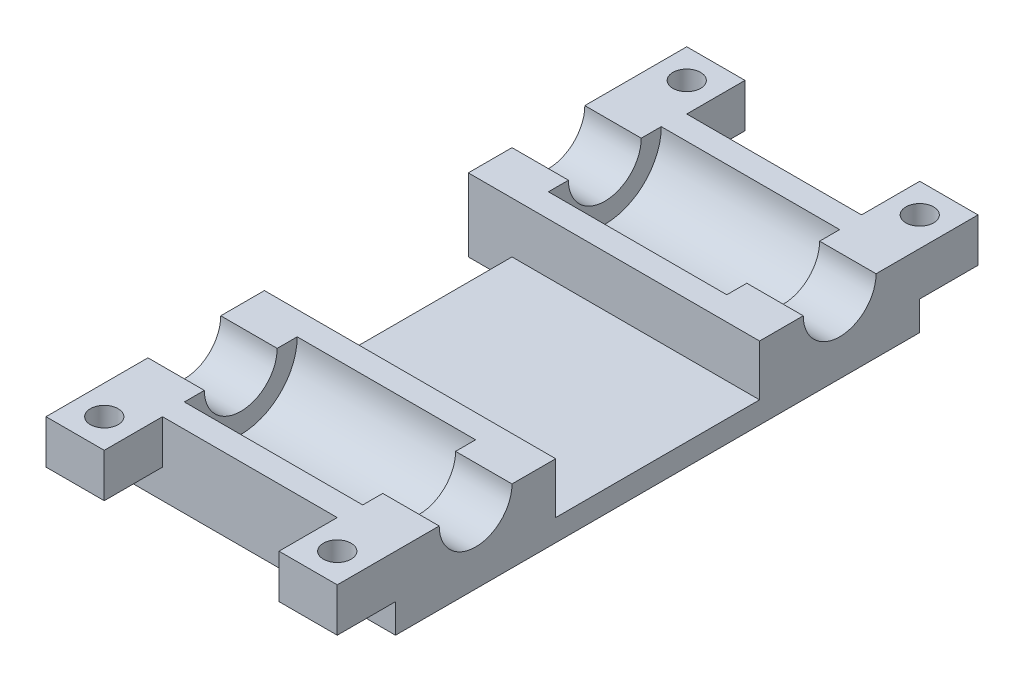
from build123d import *

# Parameters (mm, degrees)
SKETCH1_W                  = 40
SKETCH1_H                  = 22
BOSS_EXTRUDE1_DEPTH        = 11
SKETCH2_W                  = 40
SKETCH2_H                  = 22
SKETCH2_R                  = 7.843750423
BOSS_EXTRUDE2_DEPTH        = 5
SKETCH3_W                  = 24.5
SKETCH3_H                  = 15.5
CUT_EXTRUDE1_DEPTH         = 7.75
FILLET1_R                  = 7.75
SKETCH4_R                  = 5
CUT_EXTRUDE2_DEPTH         = 36.805900352
SKETCH5_W                  = 8
SKETCH5_H                  = 8
SKETCH5_R                  = 1.905800151
BOSS_EXTRUDE3_DEPTH        = 6
CUT_EXTRUDE3_START         = -3
SKETCH6_R                  = 3
SKETCH6_R_2                = 1.905800151
CUT_EXTRUDE3_DEPTH         = 3
SKETCH7_W                  = 16
SKETCH7_H                  = 16.5
BOSS_EXTRUDE5_DEPTH        = 28
MIRROR14_COPY_1_SKETCH_W   = 8
MIRROR14_COPY_1_SKETCH_H   = 8
MIRROR14_COPY_1_SKETCH_R   = 1.905800151
MIRROR14_COPY_1_DEPTH      = 6
MIRROR14_START             = -3
MIRROR14_COPY_2_SKETCH_R   = 3
MIRROR14_COPY_2_SKETCH_R_2 = 1.905800151
MIRROR14_COPY_2_DEPTH      = 3
FILLET1_OF_MIRROR14_R      = 7.75
SKETCH9_W                  = 28
SKETCH9_H                  = 3
BOSS_EXTRUDE6_DEPTH        = 18
CUT_EXTRUDE4_DEPTH         = 10
CUT_EXTRUDE5_DEPTH         = 73.919476136
CUT_EXTRUDE5_DEPTH_BACK    = 73.919476136
SKETCH11_R                 = 1.75
CUT_EXTRUDE6_DEPTH         = 76.121568141
CUT_EXTRUDE6_DEPTH_BACK    = 76.121568141
SKETCH12_R                 = 1.75
CUT_EXTRUDE9_DEPTH         = 12
CUT_EXTRUDE11_START        = -10
SKETCH16_R                 = 4
SKETCH16_R_2               = 1.75
SKETCH16_W                 = 10
SKETCH16_H                 = 6.5
CUT_EXTRUDE11_DEPTH        = 10
FILLET2_R                  = 2
SKETCH17_W                 = 34
SKETCH17_H                 = 28
CUT_EXTRUDE12_DEPTH        = 74.097537578
SKETCH18_R                 = 1.75
BOSS_EXTRUDE7_DEPTH        = 3
SKETCH19_W                 = 8
SKETCH19_H                 = 8
SKETCH19_R                 = 1.905800151
BOSS_EXTRUDE8_DEPTH        = 3
CUT_EXTRUDE13_START        = -3
SKETCH20_R                 = 1.905800151
CUT_EXTRUDE13_DEPTH        = 3
SKETCH21_W                 = 40
SKETCH21_H                 = 22
CUT_EXTRUDE14_DEPTH        = 73.532751223


# Some blends are built 0.0001 mm under size
with BuildPart() as part:
    # Sketch1 → Boss-Extrude1 (new body)
    with BuildSketch(Plane(origin=(0, 0, 0), x_dir=(1, 0, 0), z_dir=(0, 1, 0))):
        Rectangle(SKETCH1_W, SKETCH1_H)
    boss_extrude1 = extrude(amount=BOSS_EXTRUDE1_DEPTH)

    # Sketch2 → Boss-Extrude2 (add)
    with BuildSketch(Plane(origin=(0, 0, 0), x_dir=(1, 0, 0), z_dir=(0, 1, 0))):
        Rectangle(SKETCH2_W, SKETCH2_H)
        with Locations(Location((0, 0, 0), (0, 0, 270))):
            Circle(SKETCH2_R, mode=Mode.SUBTRACT)
    boss_extrude2 = extrude(amount=-BOSS_EXTRUDE2_DEPTH)

    # Sketch3 → Cut-Extrude1 (cut)
    with BuildSketch(Plane(origin=(0, 11, 0), x_dir=(1, 0, 0), z_dir=(0, 1, 0))):
        Rectangle(SKETCH3_W, SKETCH3_H)
    cut_extrude1 = extrude(amount=-CUT_EXTRUDE1_DEPTH, mode=Mode.SUBTRACT)

    # Fillet1
    fillet1_edges = [part.edges().sort_by_distance(p)[0] for p in [
        (0, 3.25, 7.75),
        (0, 3.25, -7.75),
    ]]
    fillet(fillet1_edges, radius=FILLET1_R - 0.0001)  # a hair under: the kernel refuses the full size

    # Sketch4 → Cut-Extrude2 (cut, symmetric)
    with BuildSketch(Plane(origin=(-12.25, 0, 0), x_dir=(0, 0, -1), z_dir=(1, 0, 0))):
        with Locations((0, 11)):
            Circle(SKETCH4_R)
    cut_extrude2 = extrude(amount=CUT_EXTRUDE2_DEPTH, both=True, mode=Mode.SUBTRACT)

    # Sketch5 → Boss-Extrude3 (add)
    with BuildSketch(Plane(origin=(0, 11, 0), x_dir=(1, 0, 0), z_dir=(0, 1, 0))):
        with Locations((16, -15)):
            Rectangle(SKETCH5_W, SKETCH5_H)
        with Locations(Location((16, -15, 0), (0, 0, 270))):
            Circle(SKETCH5_R, mode=Mode.SUBTRACT)
    boss_extrude3 = extrude(amount=-BOSS_EXTRUDE3_DEPTH)

    # Sketch6 → Cut-Extrude3 (cut)
    with BuildSketch(Plane.XZ.offset(-5).offset(CUT_EXTRUDE3_START)):
        with Locations(Location((16, 15, 0), (0, 0, 270))):
            Circle(SKETCH6_R)
        with Locations(Location((16, 15, 0), (0, 0, 90))):
            Circle(SKETCH6_R_2, mode=Mode.SUBTRACT)
    cut_extrude3 = extrude(amount=CUT_EXTRUDE3_DEPTH, mode=Mode.SUBTRACT)

    # Mirror8: Boss-Extrude3, Cut-Extrude3 across plane
    add(boss_extrude3.mirror(Plane(origin=(0, 0, 0), x_dir=(0, 0, 1), z_dir=(1, 0, 0))))
    add(cut_extrude3.mirror(Plane(origin=(0, 0, 0), x_dir=(0, 0, 1), z_dir=(1, 0, 0))), mode=Mode.SUBTRACT)

    # Sketch7 → Boss-Extrude5 (add)
    with BuildSketch(Plane(origin=(0, 0, -11), x_dir=(-1, 0, 0), z_dir=(0, 0, -1))):
        with Locations((-12, 9.25)):
            Rectangle(SKETCH7_W, SKETCH7_H)
    extrude(amount=BOSS_EXTRUDE5_DEPTH)

    # Mirror14: Boss-Extrude1, Boss-Extrude2, Cut-Extrude1, Cut-Extrude2, Boss-Extrude3, Cut-Extrude3 across plane
    add(boss_extrude1.mirror(Plane.XY.offset(-25)))
    add(boss_extrude2.mirror(Plane.XY.offset(-25)))
    add(cut_extrude1.mirror(Plane.XY.offset(-25)), mode=Mode.SUBTRACT)
    add(cut_extrude2.mirror(Plane.XY.offset(-25)), mode=Mode.SUBTRACT)
    add(boss_extrude3.mirror(Plane.XY.offset(-25)))
    add(cut_extrude3.mirror(Plane.XY.offset(-25)), mode=Mode.SUBTRACT)

    # Mirror14 copy 1 sketch → Mirror14 copy 1 (add)
    with BuildSketch(Plane(origin=(0, 11, -50), x_dir=(-1, 0, 0), z_dir=(0, 1, 0))):
        with Locations((16, -15)):
            Rectangle(MIRROR14_COPY_1_SKETCH_W, MIRROR14_COPY_1_SKETCH_H)
        with Locations(Location((16, -15, 0), (0, 0, 270))):
            Circle(MIRROR14_COPY_1_SKETCH_R, mode=Mode.SUBTRACT)
    extrude(amount=-MIRROR14_COPY_1_DEPTH)

    # Mirror14 copy 2 sketch → Mirror14 copy 2 (cut)
    with BuildSketch(Plane(origin=(0, 5, -50), x_dir=(-1, 0, 0), z_dir=(0, -1, 0)).offset(MIRROR14_START)):
        with Locations(Location((16, 15, 0), (0, 0, 270))):
            Circle(MIRROR14_COPY_2_SKETCH_R)
        with Locations(Location((16, 15, 0), (0, 0, 90))):
            Circle(MIRROR14_COPY_2_SKETCH_R_2, mode=Mode.SUBTRACT)
    extrude(amount=MIRROR14_COPY_2_DEPTH, mode=Mode.SUBTRACT)

    # Fillet1 of Mirror14
    fillet1_of_mirror14_edges = [part.edges().sort_by_distance(p)[0] for p in [
        (0, 3.25, -57.75),
        (0, 3.25, -42.25),
    ]]
    fillet(fillet1_of_mirror14_edges, radius=FILLET1_OF_MIRROR14_R - 0.0001)  # a hair under: the kernel refuses the full size

    # Sketch9 → Boss-Extrude6 (add)
    with BuildSketch(Plane.ZY.offset(-4)):
        with Locations((-25, 2.5)):
            Rectangle(SKETCH9_W, SKETCH9_H)
    extrude(amount=BOSS_EXTRUDE6_DEPTH)

    # Sketch10 → Cut-Extrude4 (cut)
    with BuildSketch(Plane(origin=(0, 17.5, 0), x_dir=(1, 0, 0), z_dir=(0, 1, 0))):
        with BuildLine():
            Line((9, 26.25), (9, 23.75))
            Line((9, 23.75), (11.727178029, 23.75))
            ThreePointArc((11.727178029, 23.75), (11.931001031, 24.360286817), (12, 25))
            ThreePointArc((12, 25), (11.931001031, 25.639713183), (11.727178029, 26.25))
            Line((11.727178029, 26.25), (9, 26.25))
        make_face()
        with BuildLine():
            Line((11.727178029, 23.75), (9, 23.75))
            Line((9, 23.75), (9, 26.25))
            Line((9, 26.25), (11.727178029, 26.25))
            ThreePointArc((11.727178029, 26.25), (6, 25), (11.727178029, 23.75))
        make_face()
        with BuildLine():
            ThreePointArc((12, 25), (11.931001031, 24.360286817), (11.727178029, 23.75))
            Line((11.727178029, 23.75), (20, 23.75))
            Line((20, 23.75), (20, 26.25))
            Line((20, 26.25), (11.727178029, 26.25))
            ThreePointArc((11.727178029, 26.25), (11.931001031, 25.639713183), (12, 25))
        make_face()
    extrude(amount=-CUT_EXTRUDE4_DEPTH, mode=Mode.SUBTRACT)

    # Sketch11 → Cut-Extrude5 (cut, two sides: drawn at the far end of the back side and taken through both)
    with BuildSketch(Plane(origin=(0, 7.5, 0), x_dir=(1, 0, 0), z_dir=(0, 1, 0)).offset(-CUT_EXTRUDE5_DEPTH_BACK)):
        with Locations(Location((9, 25, 0), (0, 0, 270))):
            Circle(SKETCH11_R)
    extrude(amount=CUT_EXTRUDE5_DEPTH + CUT_EXTRUDE5_DEPTH_BACK, mode=Mode.SUBTRACT)

    # Sketch12 → Cut-Extrude6 (cut, two sides: drawn at the far end of the back side and taken through both)
    with BuildSketch(Plane.ZY.offset(-4).offset(-CUT_EXTRUDE6_DEPTH_BACK)):
        with Locations((-33, 11)):
            Circle(SKETCH12_R)
    extrude(amount=CUT_EXTRUDE6_DEPTH + CUT_EXTRUDE6_DEPTH_BACK, mode=Mode.SUBTRACT)

    # Sketch15 → Cut-Extrude9 (cut)
    with BuildSketch(Plane(origin=(20, 0, 0), x_dir=(0, 0, -1), z_dir=(1, 0, 0))):
        Polygon((33, 14.175426481), (30.25, 12.58771324), (30.25, 9.41228676), (33, 7.824573519), (35.75, 9.41228676), (35.75, 12.58771324), align=None)
    extrude(amount=-CUT_EXTRUDE9_DEPTH, mode=Mode.SUBTRACT)

    # Sketch16 → Cut-Extrude11 (cut)
    # profile 1 of 2: a face of its own
    with BuildSketch(Plane(origin=(20, 0, 0), x_dir=(0, 0, -1), z_dir=(1, 0, 0)).offset(CUT_EXTRUDE11_START)):
        with Locations((33, 11)):
            Circle(SKETCH16_R)
        with Locations((33, 11)):
            Circle(SKETCH16_R_2, mode=Mode.SUBTRACT)
    # profile 2 of 2: a face of its own
    with BuildSketch(Plane(origin=(20, 0, 0), x_dir=(0, 0, -1), z_dir=(1, 0, 0)).offset(CUT_EXTRUDE11_START)):
        with Locations((34, 14.25)):
            Rectangle(SKETCH16_W, SKETCH16_H)
    extrude(amount=CUT_EXTRUDE11_DEPTH, mode=Mode.SUBTRACT)

    # Chamfer3
    # the kernel refuses this chamfer: 2.5 mm, written as the material it takes off along each edge
    with BuildSketch(Plane(origin=(4.790141486, 11, -37), x_dir=(0, -0.9712202897009368, 0.23818301550116588), z_dir=(1, 0, 0))) as chamfer3_piece_1_section:
        with BuildLine():
            Line((1.641163776, 0), (-0.550057664, 2.010038976))
            Line((-0.550057664, 2.010038976), (-0.598618679, 1.998129825))
            ThreePointArc((-0.598618679, 1.998129825), (-0.296653042, 0.999716345), (-0.048561014, -0.011909151))
            Line((-0.048561014, -0.011909151), (0.011909151, -0.048561014))
            ThreePointArc((0.011909151, -0.048561014), (0.818444442, 0.062835502), (1.633479525, -0.049405994))
            Line((1.633479525, -0.049405994), (1.641163776, 0))
        make_face()
    chamfer3_piece_1 = extrude(amount=20.419717028, mode=Mode.PRIVATE)
    chamfer3_piece_1 = split(chamfer3_piece_1, bisect_by=Plane(origin=(10, 11.063270064, -39.03704072), z_dir=(-1, 0, 0)), keep=Keep.TOP, mode=Mode.PRIVATE)
    chamfer3_piece_1 = split(chamfer3_piece_1, bisect_by=Plane(origin=(7.395070743, 11.063270064, -39), z_dir=(0, 0, -1)), keep=Keep.TOP, mode=Mode.PRIVATE)
    add(chamfer3_piece_1, mode=Mode.SUBTRACT)
    with BuildSketch(Plane(origin=(10, 11, -37), x_dir=(0, -0.9712202897009377, 0.23818301550116178), z_dir=(1, 0, 0))) as chamfer3_piece_2_section:
        with BuildLine():
            Line((1.641163776, 0), (-0.550057664, 2.010038976))
            Line((-0.550057664, 2.010038976), (-0.598618679, 1.998129825))
            ThreePointArc((-0.598618679, 1.998129825), (-0.296653042, 0.999716345), (-0.048561014, -0.011909151))
            Line((-0.048561014, -0.011909151), (0.011909151, -0.048561014))
            ThreePointArc((0.011909151, -0.048561014), (0.818444442, 0.062835502), (1.633479525, -0.049405994))
            Line((1.633479525, -0.049405994), (1.641163776, 0))
        make_face()
    chamfer3_piece_2 = extrude(amount=15.209858514, mode=Mode.PRIVATE)
    chamfer3_piece_2 = split(chamfer3_piece_2, bisect_by=Plane(origin=(17.604929257, 10.514615405, -39), z_dir=(0, 0, 1)), keep=Keep.TOP, mode=Mode.PRIVATE)
    add(chamfer3_piece_2, mode=Mode.SUBTRACT)
    with BuildSketch(Plane(origin=(10, 11, -37), x_dir=(0, -0.9712202897009377, 0.23818301550116178), z_dir=(1, 0, 0))) as chamfer3_piece_3_section:
        with BuildLine():
            Line((1.641163776, 0), (-0.550057664, 2.010038976))
            Line((-0.550057664, 2.010038976), (-0.598618679, 1.998129825))
            ThreePointArc((-0.598618679, 1.998129825), (-0.296653042, 0.999716345), (-0.048561014, -0.011909151))
            Line((-0.048561014, -0.011909151), (0.011909151, -0.048561014))
            ThreePointArc((0.011909151, -0.048561014), (0.818444442, 0.062835502), (1.633479525, -0.049405994))
            Line((1.633479525, -0.049405994), (1.641163776, 0))
        make_face()
    chamfer3_piece_3 = extrude(amount=15.209858514, mode=Mode.PRIVATE)
    chamfer3_piece_3 = split(chamfer3_piece_3, bisect_by=Plane(origin=(17.604929257, 11.063270064, -39), z_dir=(0, 0, -1)), keep=Keep.TOP, mode=Mode.PRIVATE)
    add(chamfer3_piece_3, mode=Mode.SUBTRACT)

    # Fillet2
    fillet2_edges = [part.edges().sort_by_distance(p)[0] for p in [
        (11.727178029, 12.5, -23.75),
        (11.727178029, 12.5, -26.25),
    ]]
    fillet(fillet2_edges, radius=FILLET2_R)

    # Sketch17 → Cut-Extrude12 (cut, through all)
    with BuildSketch(Plane(origin=(0, 4, 0), x_dir=(1, 0, 0), z_dir=(0, 1, 0))):
        with Locations((3, 25)):
            Rectangle(SKETCH17_W, SKETCH17_H)
    extrude(amount=CUT_EXTRUDE12_DEPTH, mode=Mode.SUBTRACT)

    # Sketch18 → Boss-Extrude7 (add)
    with BuildSketch(Plane(origin=(0, 4, 0), x_dir=(1, 0, 0), z_dir=(0, 1, 0))):
        with Locations((9, 25)):
            Circle(SKETCH18_R)
    extrude(amount=-BOSS_EXTRUDE7_DEPTH)

    # Sketch19 → Boss-Extrude8 (add)
    # profile 1 of 4: a face of its own
    with BuildSketch(Plane.XZ.offset(-8)):
        with Locations((-16, -65)):
            Rectangle(SKETCH19_W, SKETCH19_H)
        with Locations(Location((-16, -65, 0), (0, 0, 270))):
            Circle(SKETCH19_R, mode=Mode.SUBTRACT)
    # profile 2 of 4: a face of its own
    with BuildSketch(Plane.XZ.offset(-8)):
        with Locations((16, -65)):
            Rectangle(SKETCH19_W, SKETCH19_H)
        with Locations(Location((16, -65, 0), (0, 0, 270))):
            Circle(SKETCH19_R, mode=Mode.SUBTRACT)
    # profile 3 of 4: a face of its own
    with BuildSketch(Plane.XZ.offset(-8)):
        with Locations((16, 15)):
            Rectangle(SKETCH19_W, SKETCH19_H)
        with Locations(Location((16, 15, 0), (0, 0, 90))):
            Circle(SKETCH19_R, mode=Mode.SUBTRACT)
    # profile 4 of 4: a face of its own
    with BuildSketch(Plane.XZ.offset(-8)):
        with Locations((-16, 15)):
            Rectangle(SKETCH19_W, SKETCH19_H)
        with Locations(Location((-16, 15, 0), (0, 0, 90))):
            Circle(SKETCH19_R, mode=Mode.SUBTRACT)
    extrude(amount=BOSS_EXTRUDE8_DEPTH)

    # Sketch20 → Cut-Extrude13 (cut)
    # profile 1 of 4: a face of its own
    with BuildSketch(Plane.XZ.offset(-5).offset(CUT_EXTRUDE13_START)):
        Polygon((-12.824573519, 15), (-14.41228676, 17.75), (-17.58771324, 17.75), (-19.175426481, 15), (-17.58771324, 12.25), (-14.41228676, 12.25), align=None)
        with Locations(Location((-16, 15, 0), (0, 0, 90))):
            Circle(SKETCH20_R, mode=Mode.SUBTRACT)
    # profile 2 of 4: a face of its own
    with BuildSketch(Plane.XZ.offset(-5).offset(CUT_EXTRUDE13_START)):
        Polygon((19.175426481, 15), (17.58771324, 17.75), (14.41228676, 17.75), (12.824573519, 15), (14.41228676, 12.25), (17.58771324, 12.25), align=None)
        with Locations(Location((16, 15, 0), (0, 0, 90))):
            Circle(SKETCH20_R, mode=Mode.SUBTRACT)
    # profile 3 of 4: a face of its own
    with BuildSketch(Plane.XZ.offset(-5).offset(CUT_EXTRUDE13_START)):
        Polygon((19.175426481, -65), (17.58771324, -62.25), (14.41228676, -62.25), (12.824573519, -65), (14.41228676, -67.75), (17.58771324, -67.75), align=None)
        with Locations(Location((16, -65, 0), (0, 0, 270))):
            Circle(SKETCH20_R, mode=Mode.SUBTRACT)
    # profile 4 of 4: a face of its own
    with BuildSketch(Plane.XZ.offset(-5).offset(CUT_EXTRUDE13_START)):
        Polygon((-12.824573519, -65), (-14.41228676, -62.25), (-17.58771324, -62.25), (-19.175426481, -65), (-17.58771324, -67.75), (-14.41228676, -67.75), align=None)
        with Locations(Location((-16, -65, 0), (0, 0, 270))):
            Circle(SKETCH20_R, mode=Mode.SUBTRACT)
    extrude(amount=CUT_EXTRUDE13_DEPTH, mode=Mode.SUBTRACT)

    # Sketch21 → Cut-Extrude14 (cut, through all)
    with BuildSketch(Plane.XZ.offset(-1)):
        with Locations((0, -50)):
            Rectangle(SKETCH21_W, SKETCH21_H)
        Rectangle(SKETCH21_W, SKETCH21_H)
    extrude(amount=CUT_EXTRUDE14_DEPTH, mode=Mode.SUBTRACT)


solid = part.part
